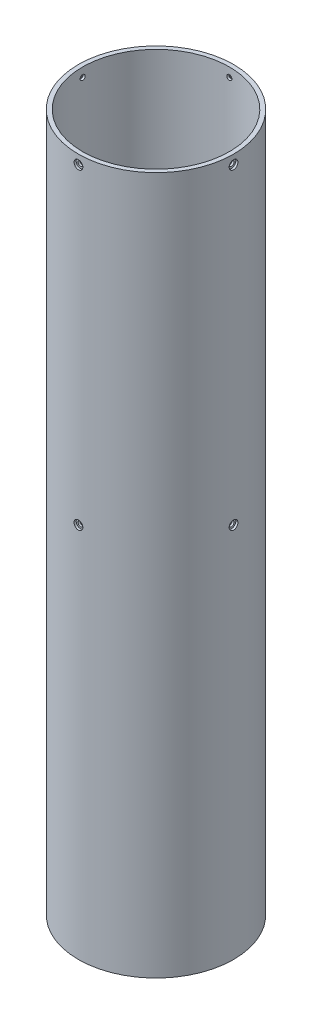
from build123d import *

# Parameters (mm, degrees)
SKETCH1_R                         = 53.721
SKETCH1_R_2                       = 50.8
BODY_EXTRUSION_DEPTH              = 482.6
UPPER_BULKHEAD_HOLES_REACH        = 499.325
SKETCH2_R                         = 1.7526
UPPER_BULKHEAD_HOLE_PATTERN_COUNT = 4
LOWER_BULKHEAD_HOLES_REACH        = 499.325
SKETCH3_R                         = 1.7526
LOWER_BULKHEAD_HOLE_PATTERN_COUNT = 4
SKETCH4_R                         = 3.0226
COUNTERSINK_DEPTH                 = 1.524
COUNTERSINK_PATTERN_COUNT         = 4


with BuildPart() as part:
    # Sketch1 → Body Extrusion (new body)
    with BuildSketch(Plane(origin=(0, 0, 0), x_dir=(1, 0, 0), z_dir=(0, 1, 0))):
        Circle(SKETCH1_R)
        Circle(SKETCH1_R_2, mode=Mode.SUBTRACT)
    extrude(amount=BODY_EXTRUSION_DEPTH)

    # Sketch2 → Upper Bulkhead Holes (cut, up to next)
    with BuildSketch(Plane.XY.offset(53.721), mode=Mode.PRIVATE) as upper_bulkhead_holes_sk1:
        with Locations((0, 476.25)):
            Circle(SKETCH2_R)
    upper_bulkhead_holes_tool1 = extrude(upper_bulkhead_holes_sk1.sketch, amount=-UPPER_BULKHEAD_HOLES_REACH, mode=Mode.PRIVATE) & part.part
    upper_bulkhead_holes = upper_bulkhead_holes_tool1.solids().sort_by_distance((0, 476.25, 53.721))[0]
    add(upper_bulkhead_holes, mode=Mode.SUBTRACT)

    # Upper Bulkhead Hole Pattern: Upper Bulkhead Holes ×4 about axis
    upper_bulkhead_hole_pattern_axis = Axis((0, 482.6, 0), (0, -1, 0))
    for i in range(1, UPPER_BULKHEAD_HOLE_PATTERN_COUNT):
        add(upper_bulkhead_holes.rotate(upper_bulkhead_hole_pattern_axis, i * 360 / UPPER_BULKHEAD_HOLE_PATTERN_COUNT), mode=Mode.SUBTRACT)

    # Sketch3 → Lower Bulkhead Holes (cut, up to next)
    with BuildSketch(Plane.XY.offset(53.721), mode=Mode.PRIVATE) as lower_bulkhead_holes_sk1:
        with Locations((0, 260.35)):
            Circle(SKETCH3_R)
    lower_bulkhead_holes_tool1 = extrude(lower_bulkhead_holes_sk1.sketch, amount=-LOWER_BULKHEAD_HOLES_REACH, mode=Mode.PRIVATE) & part.part
    lower_bulkhead_holes = lower_bulkhead_holes_tool1.solids().sort_by_distance((0, 260.35, 53.721))[0]
    add(lower_bulkhead_holes, mode=Mode.SUBTRACT)

    # Lower Bulkhead Hole Pattern: Lower Bulkhead Holes ×4 about axis
    lower_bulkhead_hole_pattern_axis = Axis((0, 482.6, 0), (0, -1, 0))
    for i in range(1, LOWER_BULKHEAD_HOLE_PATTERN_COUNT):
        add(lower_bulkhead_holes.rotate(lower_bulkhead_hole_pattern_axis, i * 360 / LOWER_BULKHEAD_HOLE_PATTERN_COUNT), mode=Mode.SUBTRACT)

    # Sketch4 → Countersink (cut)
    with BuildSketch(Plane.XY.offset(53.721)):
        with Locations((0, 476.25)):
            Circle(SKETCH4_R)
        with Locations((0, 260.35)):
            Circle(SKETCH4_R)
    countersink = extrude(amount=-COUNTERSINK_DEPTH, mode=Mode.SUBTRACT)

    # Countersink Pattern: Countersink ×4 about axis
    countersink_pattern_axis = Axis((0, 482.6, 0), (0, -1, 0))
    for i in range(1, COUNTERSINK_PATTERN_COUNT):
        add(countersink.rotate(countersink_pattern_axis, i * 360 / COUNTERSINK_PATTERN_COUNT), mode=Mode.SUBTRACT)


solid = part.part
